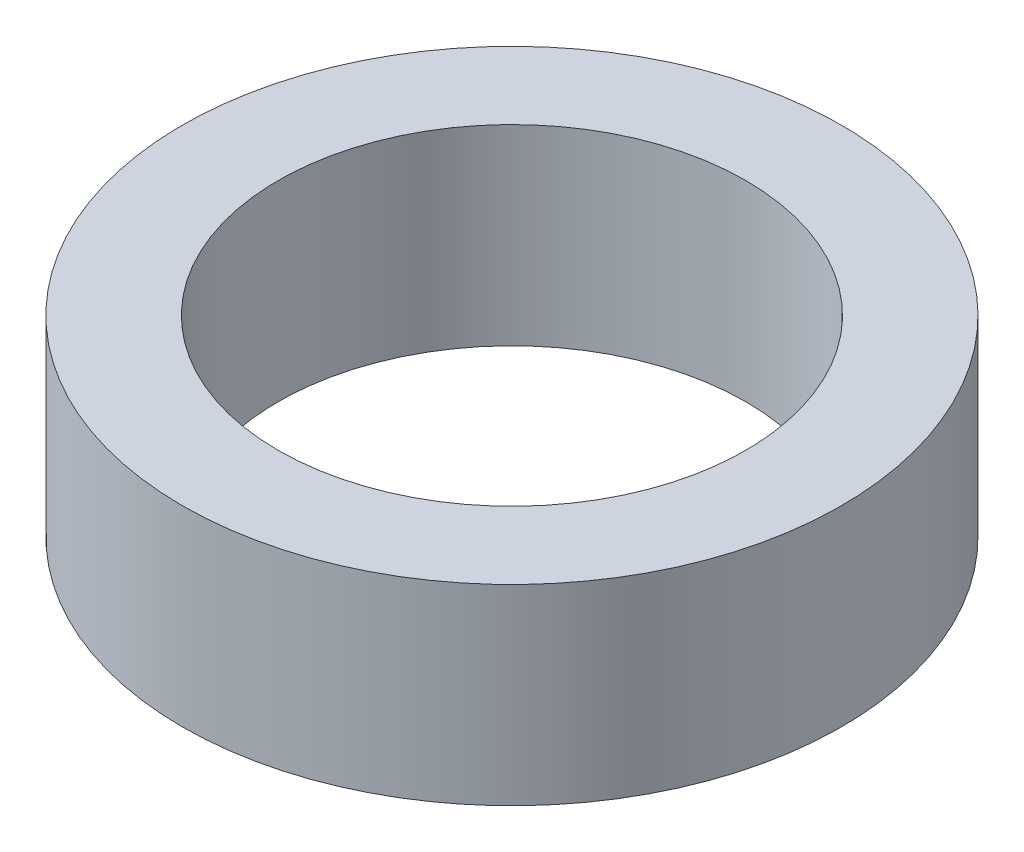
from build123d import *

# Parameters (mm, degrees)
SKETCH1_R           = 8.6
SKETCH1_R_2         = 6.1
BOSS_EXTRUDE1_DEPTH = 5


with BuildPart() as part:
    # Sketch1 → Boss-Extrude1 (new body)
    with BuildSketch(Plane(origin=(0, 0, 0), x_dir=(1, 0, 0), z_dir=(0, 1, 0))):
        Circle(SKETCH1_R)
        Circle(SKETCH1_R_2, mode=Mode.SUBTRACT)
    extrude(amount=BOSS_EXTRUDE1_DEPTH)


solid = part.part
